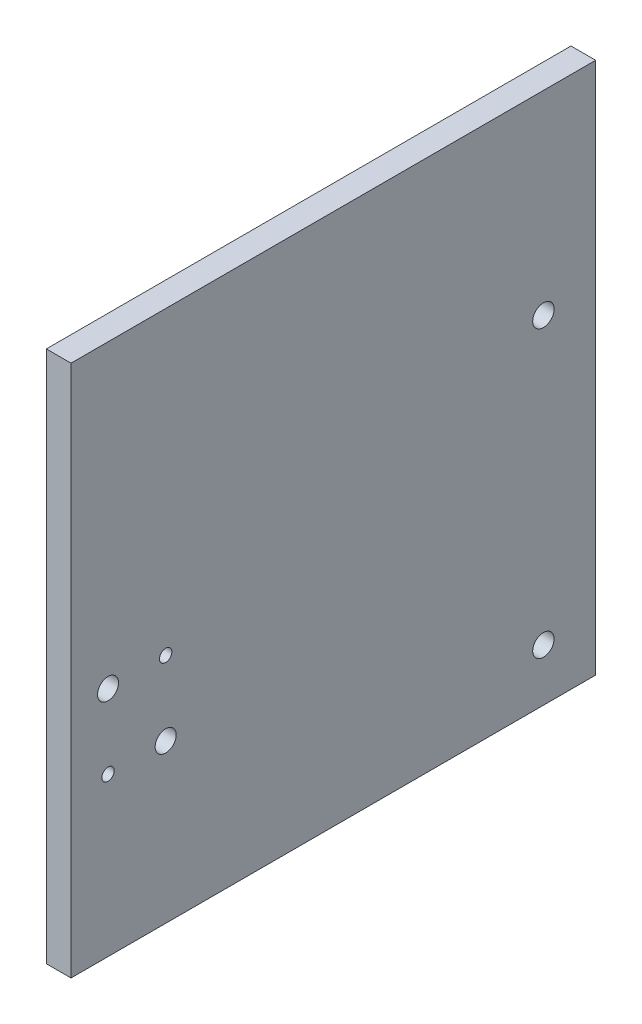
from build123d import *

# Parameters (mm, degrees)
SKETCH1_R           = 1.5
SKETCH1_R_2         = 2.555
SKETCH1_R_3         = 2.6
BOSS_EXTRUDE1_DEPTH = 6


with BuildPart() as part:
    # Sketch1 → Boss-Extrude1 (new body)
    with BuildSketch(Plane.YZ):
        Polygon((-47.4, 16), (47.4, 16), (82, 16), (82, -111.5), (47.4, -111.5), (-47.4, -111.5), (-47.4, -25), align=None)
        with Locations((-9, 7)):
            Circle(SKETCH1_R, mode=Mode.SUBTRACT)
        with Locations((-9, -7)):
            Circle(SKETCH1_R_2, mode=Mode.SUBTRACT)
        with Locations((9, -7)):
            Circle(SKETCH1_R, mode=Mode.SUBTRACT)
        with Locations((9, 7)):
            Circle(SKETCH1_R_2, mode=Mode.SUBTRACT)
        with Locations((-34.7, -98.8)):
            Circle(SKETCH1_R_3, mode=Mode.SUBTRACT)
        with Locations((34.7, -98.8)):
            Circle(SKETCH1_R_3, mode=Mode.SUBTRACT)
    extrude(amount=BOSS_EXTRUDE1_DEPTH)


solid = part.part
